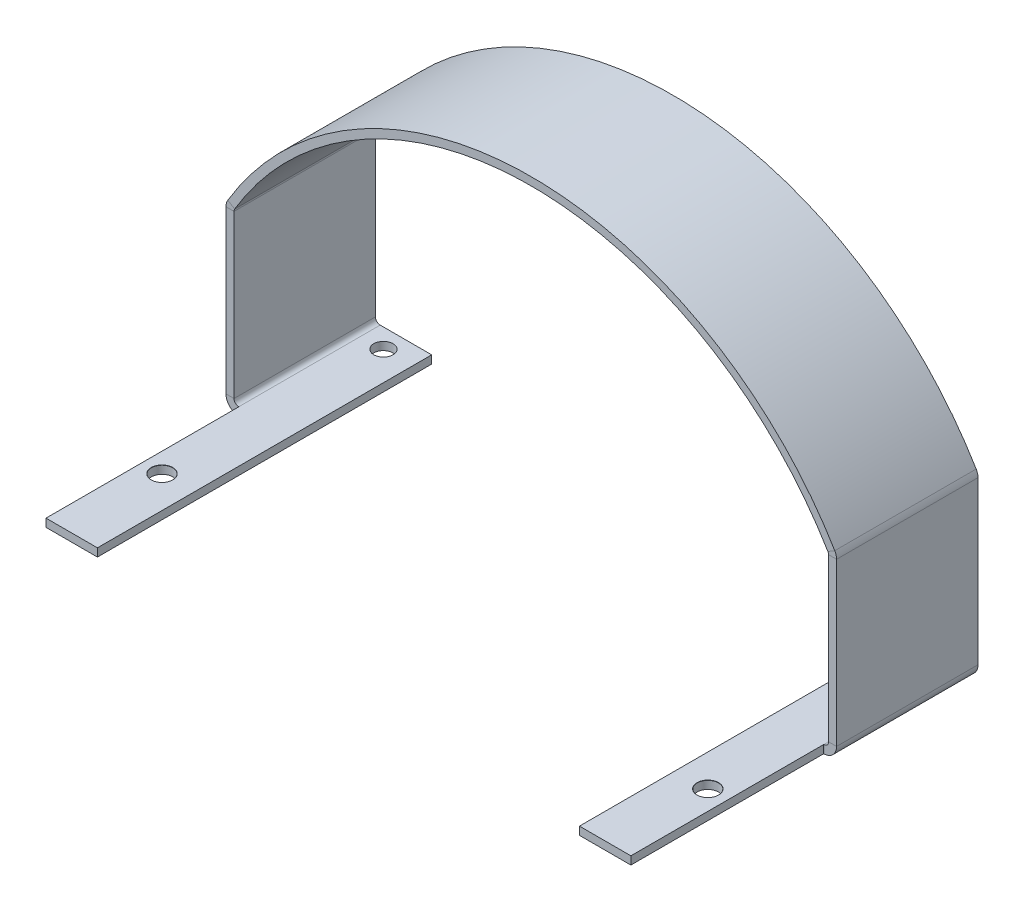
from build123d import *

# Parameters (mm, degrees)
BASE_FLANGE1_START                    = -1
BASE_FLANGE1_DEPTH                    = 22
SKETCH37_W                            = 8
SKETCH37_H                            = 30
BOSS_EXTRUDE1_DEPTH                   = 1.25
TAP_DRILL_FOR_M4X0_7_TAP1_D           = 3.3
TAP_DRILL_FOR_M4X0_7_TAP1_DEPTH       = 10
TAP_DRILL_FOR_M4X0_7_TAP1_CSINK_D     = 3.35
TAP_DRILL_FOR_M4X0_7_TAP1_CSINK_ANGLE = 90
TAP_DRILL_FOR_M4X0_7_TAP1_TIP         = 0.991420021
SKETCH36_R                            = 1.5
CUT_EXTRUDE1_DEPTH                    = 10


# Read off the part's stored shape, not the designer's step: Base-Flange1
with BuildPart() as part:
    # Base-Flange1 outline → Base-Flange1 (new body)
    with BuildSketch(Plane.XY.offset(BASE_FLANGE1_START)):
        with BuildLine():
            Line((-45.506078027, 0), (-37.492678027, 0))
            Line((-37.492678027, 0), (-37.492678027, 1.25))
            Line((-37.492678027, 1.25), (-45.506078027, 1.25))
            ThreePointArc((-45.506078027, 1.25), (-46.026932882, 1.465745145), (-46.242678027, 1.9866))
            Line((-46.242678027, 1.9866), (-46.242678027, 27.195908555))
            ThreePointArc((-46.242678027, 27.195908555), (-46.216121498, 27.391913221), (-46.138366789, 27.573784833))
            ThreePointArc((-46.138366789, 27.573784833), (0, 53.75), (46.138366789, 27.573784833))
            ThreePointArc((46.138366789, 27.573784833), (46.216121498, 27.391913221), (46.242678027, 27.195908555))
            Line((46.242678027, 27.195908555), (46.242678027, 1.9866))
            ThreePointArc((46.242678027, 1.9866), (46.026932882, 1.465745145), (45.506078027, 1.25))
            Line((45.506078027, 1.25), (37.492678027, 1.25))
            Line((37.492678027, 1.25), (37.492678027, 0))
            Line((37.492678027, 0), (45.506078027, 0))
            ThreePointArc((45.506078027, 0), (46.910816359, 0.581861668), (47.492678027, 1.9866))
            Line((47.492678027, 1.9866), (47.492678027, 27.195908555))
            ThreePointArc((47.492678027, 27.195908555), (47.421055437, 27.724530423), (47.211352064, 28.215035643))
            ThreePointArc((47.211352064, 28.215035643), (0, 55), (-47.211352064, 28.215035643))
            ThreePointArc((-47.211352064, 28.215035643), (-47.421055437, 27.724530423), (-47.492678027, 27.195908555))
            Line((-47.492678027, 27.195908555), (-47.492678027, 1.9866))
            ThreePointArc((-47.492678027, 1.9866), (-46.910816359, 0.581861668), (-45.506078027, 0))
        make_face()
    extrude(amount=BASE_FLANGE1_DEPTH)

    # Sketch37 → Boss-Extrude1 (add)
    with BuildSketch(Plane(origin=(0, 1.25, 0), x_dir=(1, 0, 0), z_dir=(0, 1, 0))):
        with Locations((41.492678027, -36)):
            Rectangle(SKETCH37_W, SKETCH37_H)
        with Locations((-41.492678027, -36)):
            Rectangle(SKETCH37_W, SKETCH37_H)
    extrude(amount=-BOSS_EXTRUDE1_DEPTH)

    # Tap Drill for M4x0.7 Tap1
    with Locations(Plane(origin=(0, 1.25, 0), x_dir=(1, 0, 0), z_dir=(0, 1, 0))):
        with Locations((-42.455982414, -35.991709022), (42.455982414, -35.991709022)):
            CounterSinkHole(TAP_DRILL_FOR_M4X0_7_TAP1_D / 2, TAP_DRILL_FOR_M4X0_7_TAP1_CSINK_D / 2, depth=TAP_DRILL_FOR_M4X0_7_TAP1_DEPTH, counter_sink_angle=TAP_DRILL_FOR_M4X0_7_TAP1_CSINK_ANGLE)
            with Locations((0, 0, -(TAP_DRILL_FOR_M4X0_7_TAP1_DEPTH + TAP_DRILL_FOR_M4X0_7_TAP1_TIP / 2))):  # 118° drill point
                Cone(0, TAP_DRILL_FOR_M4X0_7_TAP1_D / 2, TAP_DRILL_FOR_M4X0_7_TAP1_TIP, mode=Mode.SUBTRACT)

    # Sketch36 → Cut-Extrude1 (cut)
    with BuildSketch(Plane(origin=(0, 1.25, 0), x_dir=(1, 0, 0), z_dir=(0, 1, 0))):
        with Locations(Location((42.000000004, -2, 0), (0, 0, 180))):
            Circle(SKETCH36_R)
        with Locations(Location((-42.000000004, -2, 0), (0, 0, 270))):
            Circle(SKETCH36_R)
    extrude(amount=-CUT_EXTRUDE1_DEPTH, mode=Mode.SUBTRACT)


solid = part.part
